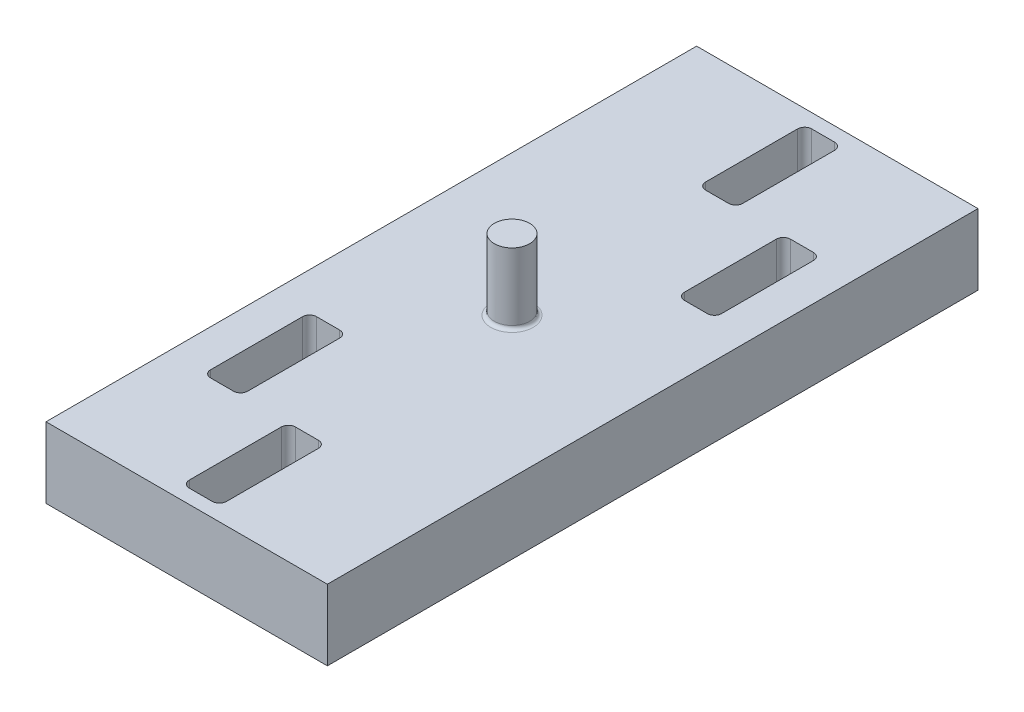
from build123d import *

# Parameters (mm, degrees)
BOSS_EXTRUDE1_DEPTH  = 10
FILLET2_R            = 1
FILLET2_OF_MIRROR1_R = 1
CUT_EXTRUDE1_DEPTH   = 81.635062113
FILLET3_R            = 1
SKETCH5_R            = 2.5
BOSS_EXTRUDE2_DEPTH  = 10
FILLET1_R            = 0.5


with BuildPart() as part:
    # Sketch2 → Boss-Extrude1 (new body)
    with BuildSketch(Plane(origin=(0, 0, 0), x_dir=(1, 0, 0), z_dir=(0, 1, 0))):
        Polygon((-19.893799085, 77.5), (0, 77.5), (0, 75.5), (-2.625, 75.5), (-2.625, 73), (-2.625, 63), (-2.625, 60.5), (0, 60.5), (0, 60.375), (0, 2.5), (-2.625, 2.5), (-2.625, 0), (-2.625, -10), (-2.625, -12.5), (0, -12.5), (0, -14.5), (-19.893799085, -14.5), align=None)
    boss_extrude1 = extrude(amount=BOSS_EXTRUDE1_DEPTH)

    # Fillet2
    fillet2_edges = [part.edges().sort_by_distance(p)[0] for p in [
        (-2.625, 5, 12.5),
        (-2.625, 5, -2.5),
        (-2.625, 5, -60.5),
        (-2.625, 5, -75.5),
    ]]
    fillet(fillet2_edges, radius=FILLET2_R)

    # Mirror1: Boss-Extrude1 across Right Plane
    add(boss_extrude1.mirror(Plane(origin=(0, 0, 0), x_dir=(0, 0, -1), z_dir=(1, 0, 0))))

    # Fillet2 of Mirror1
    fillet2_of_mirror1_edges = [part.edges().sort_by_distance(p)[0] for p in [
        (2.625, 5, 12.5),
        (2.625, 5, -2.5),
        (2.625, 5, -60.5),
        (2.625, 5, -75.5),
    ]]
    fillet(fillet2_of_mirror1_edges, radius=FILLET2_OF_MIRROR1_R)

    # Sketch4 → Cut-Extrude1 (cut, through all)
    with BuildSketch(Plane(origin=(0, 0, 0), x_dir=(1, 0, 0), z_dir=(0, 1, 0))):
        Polygon((-14.625, 15), (-14.625, 5), (-14.625, 2.5), (-12, 2.5), (-9.375, 2.5), (-9.375, 5), (-9.375, 15), (-9.375, 17.5), (-12, 17.5), (-14.625, 17.5), align=None)
        Polygon((9.375, 58), (9.375, 48), (9.375, 45.5), (12, 45.5), (14.625, 45.5), (14.625, 48), (14.625, 58), (14.625, 60.5), (12, 60.5), (9.375, 60.5), align=None)
    extrude(amount=CUT_EXTRUDE1_DEPTH, mode=Mode.SUBTRACT)

    # Fillet3
    fillet3_edges = [part.edges().sort_by_distance(p)[0] for p in [
        (9.375, 5, -45.5),
        (14.625, 5, -45.5),
        (9.375, 5, -60.5),
        (14.625, 5, -60.5),
        (-14.625, 5, -2.5),
        (-9.375, 5, -2.5),
        (-9.375, 5, -17.5),
        (-14.625, 5, -17.5),
    ]]
    fillet(fillet3_edges, radius=FILLET3_R)

    # Sketch5 → Boss-Extrude2 (add)
    with BuildSketch(Plane(origin=(0, 10, 0), x_dir=(1, 0, 0), z_dir=(0, 1, 0))):
        with Locations((0, 31.5)):
            Circle(SKETCH5_R)
    extrude(amount=BOSS_EXTRUDE2_DEPTH)

    # Fillet1
    fillet1_edges = [part.edges().sort_by_distance(p)[0] for p in [
        (-2.5, 10, -31.5),
    ]]
    fillet(fillet1_edges, radius=FILLET1_R)


solid = part.part
